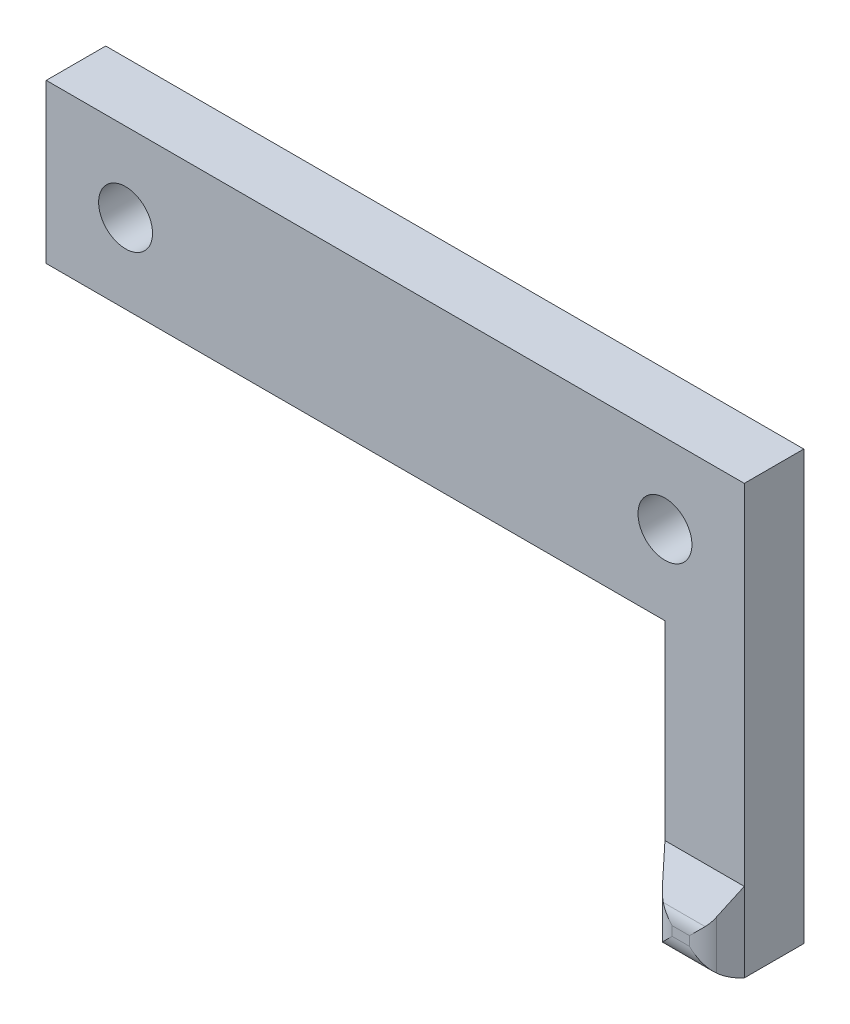
from build123d import *

# Parameters (mm, degrees)
SKETCH1_W           = 88
SKETCH1_H           = 20
SKETCH1_R           = 3.4
BOSS_EXTRUDE1_DEPTH = 7.5
SKETCH2_W           = 10
SKETCH2_H           = 7.5
BOSS_EXTRUDE2_DEPTH = 34
FILLET1_R           = 3


with BuildPart() as part:
    # Sketch1 → Boss-Extrude1 (new body)
    with BuildSketch(Plane.XY):
        with Locations((34, 0)):
            Rectangle(SKETCH1_W, SKETCH1_H)
        Circle(SKETCH1_R, mode=Mode.SUBTRACT)
        with Locations((68, 0)):
            Circle(SKETCH1_R, mode=Mode.SUBTRACT)
    extrude(amount=BOSS_EXTRUDE1_DEPTH)

    # Sketch2 → Boss-Extrude2 (add)
    with BuildSketch(Plane.XZ.offset(10)):
        with Locations((73, 3.75)):
            Rectangle(SKETCH2_W, SKETCH2_H)
    extrude(amount=BOSS_EXTRUDE2_DEPTH)

    # Sketch4 → Loft1 section 0
    with BuildSketch(Plane.XY.offset(7.5)):
        with BuildLine():
            Line((78, -44), (68, -44))
            Line((68, -44), (68, -34))
            Line((68, -34), (78, -34))
            Line((78, -34), (78, -44))
        make_face()
    # Sketch3 → Loft1 section 1
    with BuildSketch(Plane.XY.offset(10.5)):
        with BuildLine():
            Line((75.5, -39), (70.5, -39))
            Line((70.5, -39), (70.5, -44))
            Line((70.5, -44), (75.5, -44))
            Line((75.5, -44), (75.5, -39))
        make_face()
    loft()

    # Fillet1
    fillet1_edges = [part.edges().sort_by_distance(p)[0] for p in [
        (73, -39, 10.5),
        (75.5, -41.5, 10.5),
        (73, -44, 10.5),
        (70.5, -41.5, 10.5),
    ]]
    fillet(fillet1_edges, radius=FILLET1_R - 0.0001)  # a hair under: the kernel refuses the full size


solid = part.part
